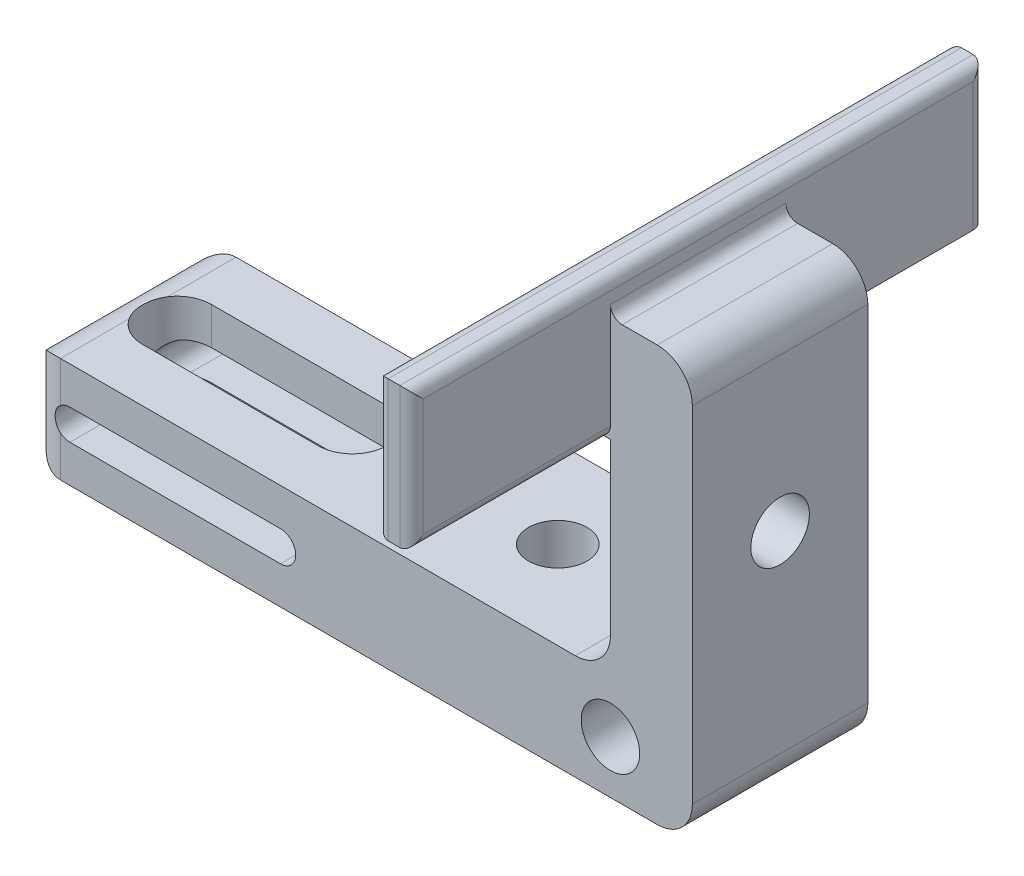
from build123d import *

# Parameters (mm, degrees)
BOSS_EXTRUDE1_DEPTH = 15
CUT_EXTRUDE1_DEPTH  = 69.805886376
CUT_EXTRUDE2_DEPTH  = 69.805886376
SKETCH4_W           = 49
SKETCH4_H           = 12
BOSS_EXTRUDE2_DEPTH = 3
SKETCH5_R           = 2.5
CUT_EXTRUDE3_DEPTH  = 76.863364017
FILLET1_R           = 3
FILLET2_R           = 3
FILLET3_R           = 1
FILLET4_R           = 3
FILLET5_R           = 1
SKETCH6_R           = 2.5
CUT_EXTRUDE4_DEPTH  = 71.754858561
SKETCH7_R           = 2.5
CUT_EXTRUDE5_DEPTH  = 72.716455573


with BuildPart() as part:
    # Sketch1 → Boss-Extrude1 (new body)
    with BuildSketch(Plane.XY):
        Polygon((0, 0), (57, 0), (57, 35.5), (50, 35.5), (50, 9), (0, 9), align=None)
    extrude(amount=-BOSS_EXTRUDE1_DEPTH)

    # Sketch2 → Cut-Extrude1 (cut, through all)
    with BuildSketch(Plane.XZ):
        with BuildLine():
            Line((5.45, -4.55), (20.45, -4.55))
            ThreePointArc((20.45, -4.55), (23.4, -7.5), (20.45, -10.45))
            Line((20.45, -10.45), (5.45, -10.45))
            ThreePointArc((5.45, -10.45), (2.5, -7.5), (5.45, -4.55))
        make_face()
    extrude(amount=-CUT_EXTRUDE1_DEPTH, mode=Mode.SUBTRACT)

    # Sketch3 → Cut-Extrude2 (cut, through all)
    with BuildSketch(Plane.XY):
        with BuildLine():
            Line((3.8, 5.8), (21.8, 5.8))
            ThreePointArc((21.8, 5.8), (23.1, 4.5), (21.8, 3.2))
            Line((21.8, 3.2), (3.8, 3.2))
            ThreePointArc((3.8, 3.2), (2.5, 4.5), (3.8, 5.8))
        make_face()
    extrude(amount=-CUT_EXTRUDE2_DEPTH, mode=Mode.SUBTRACT)

    # Sketch4 → Boss-Extrude2 (add)
    with BuildSketch(Plane.ZY.offset(-50)):
        with Locations((-7.5, 32.5)):
            Rectangle(SKETCH4_W, SKETCH4_H)
    extrude(amount=BOSS_EXTRUDE2_DEPTH)

    # Sketch5 → Cut-Extrude3 (cut, through all)
    with BuildSketch(Plane.XY):
        with Locations((50, 4.5)):
            Circle(SKETCH5_R)
    extrude(amount=-CUT_EXTRUDE3_DEPTH, mode=Mode.SUBTRACT)

    # Fillet1
    fillet1_edges = [part.edges().sort_by_distance(p)[0] for p in [
        (50, 9, -7.5),
        (57, 0, -7.5),
    ]]
    fillet(fillet1_edges, radius=FILLET1_R)

    # Fillet2
    # the kernel refuses this fillet: 3 mm, written as the material it takes off along each edge
    with BuildSketch(Plane(origin=(0, 9, 7.5), x_dir=(0, -1, 0), z_dir=(0, 0, -1)), Plane(origin=(0, 0, 7.5), x_dir=(1, 0, 0), z_dir=(0, 0, -1))) as fillet2_piece_1:
        with BuildLine():
            CenterArc((FILLET2_R, -FILLET2_R), FILLET2_R, 90, 90)
            Line((0, -FILLET2_R), (0, 0))
            Line((0, 0), (FILLET2_R, 0))
        make_face()
    extrude(amount=30, mode=Mode.SUBTRACT)
    with BuildSketch(Plane(origin=(0, 16.5, -15), x_dir=(0, 0, 1), z_dir=(0, -1, 0)), Plane(origin=(0, 16.5, 0), x_dir=(1, 0, 0), z_dir=(0, -1, 0))) as fillet2_piece_2:
        with BuildLine():
            CenterArc((FILLET2_R, -FILLET2_R), FILLET2_R, 90, 90)
            Line((0, -FILLET2_R), (0, 0))
            Line((0, 0), (FILLET2_R, 0))
        make_face()
    extrude(amount=24, mode=Mode.SUBTRACT)

    # Fillet3
    fillet3_edges = [part.edges().sort_by_distance(p)[0] for p in [
        (50, 26.5, 8.5),
        (50, 32.5, -32),
        (50, 38.5, -7.5),
        (50, 32.5, 17),
        (47, 32.5, -32),
        (47, 32.5, 17),
        (47, 26.5, -7.5),
        (47, 38.5, -7.5),
    ]]
    fillet(fillet3_edges, radius=FILLET3_R)

    # Fillet4
    fillet4_edges = [part.edges().sort_by_distance(p)[0] for p in [
        (57, 35.5, -7.5),
    ]]
    fillet(fillet4_edges, radius=FILLET4_R)

    # Fillet5
    fillet5_edges = [part.edges().sort_by_distance(p)[0] for p in [
        (50, 35.5, -7.5),
    ]]
    fillet(fillet5_edges, radius=FILLET5_R)

    # Sketch6 → Cut-Extrude4 (cut, through all)
    with BuildSketch(Plane.ZY.offset(-50)):
        with Locations((-7.5, 19.488510255)):
            Circle(SKETCH6_R)
    extrude(amount=-CUT_EXTRUDE4_DEPTH, mode=Mode.SUBTRACT)

    # Sketch7 → Cut-Extrude5 (cut, through all)
    with BuildSketch(Plane(origin=(0, 9, 0), x_dir=(1, 0, 0), z_dir=(0, 1, 0))):
        with Locations(Location((38, 7.5, 0), (0, 0, 180))):
            Circle(SKETCH7_R)
    extrude(amount=-CUT_EXTRUDE5_DEPTH, mode=Mode.SUBTRACT)


solid = part.part
